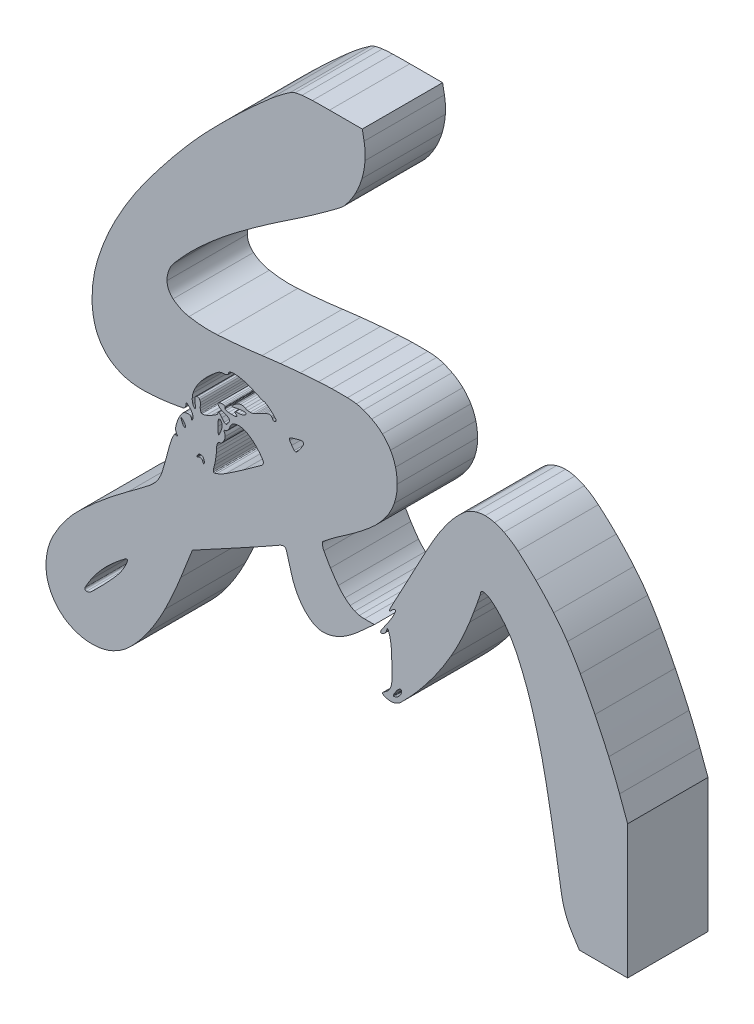
from build123d import *

# Parameters (mm, degrees)
BOSS_EXTRUDE1_DEPTH   = 30
BOSS_EXTRUDE1_2_DEPTH = 30
SCALE2_SCALE          = 5


with BuildPart() as part:
    # Sketch2 → Boss-Extrude1 (new body)
    with BuildSketch(Plane.XY):
        with BuildLine():
            ThreePointArc((52.205933, 32.830719), (55.316604025, 39.403493278), (58.132456, 46.107866))
            Line((58.132456, 46.107866), (62.463316, 57.096483))
            Line((62.463316, 57.096483), (75.981658, 64.427074))
            Line((75.981658, 64.427074), (81.431842, 67.396196))
            Line((81.431842, 67.396196), (86.628988, 70.255491))
            Line((86.628988, 70.255491), (91.027627, 72.699646))
            ThreePointArc((91.027627, 72.699646), (92.140192237, 73.330038689), (93.244684, 73.974472))
            ThreePointArc((93.244684, 73.974472), (94.193405236, 74.518840057), (95.156561, 75.037241))
            ThreePointArc((95.156561, 75.037241), (95.714736364, 75.280653681), (96.301076, 75.445017))
            ThreePointArc((96.301076, 75.445017), (96.661628518, 75.458328401), (97.006526, 75.352399))
            ThreePointArc((97.006526, 75.352399), (97.277256305, 75.142458922), (97.448336, 74.84564))
            ThreePointArc((97.448336, 74.84564), (97.584722485, 74.432549329), (97.712977, 74.016862))
            Line((97.712977, 74.016862), (98.252096, 72.190637))
            Line((98.252096, 72.190637), (98.881252, 70.017478))
            Line((98.881252, 70.017478), (99.540031, 67.696954))
            ThreePointArc((99.540031, 67.696954), (100.399634862, 65.158441242), (101.51929, 62.723418))
            ThreePointArc((101.51929, 62.723418), (102.821242901, 60.587452164), (104.385908, 58.635721))
            ThreePointArc((104.385908, 58.635721), (105.957436057, 57.154340061), (107.732624, 55.924341))
            ThreePointArc((107.732624, 55.924341), (109.370702684, 55.23520604), (111.132204, 55))
            ThreePointArc((111.132204, 55), (112.767826971, 55.112390142), (114.372704, 55.447448))
            ThreePointArc((114.372704, 55.447448), (116.076992824, 56.024401221), (117.712184, 56.775151))
            ThreePointArc((117.712184, 56.775151), (119.572331008, 57.850651444), (121.336141, 59.077771))
            ThreePointArc((121.336141, 59.077771), (123.434394622, 60.745044208), (125.458063, 62.502097))
            Line((125.458063, 62.502097), (130.416127, 67))
            Line((130.416127, 67), (126.74286, 67))
            ThreePointArc((126.74286, 67), (125.776359578, 67.044804048), (124.818149, 67.17883))
            ThreePointArc((124.818149, 67.17883), (123.937282305, 67.395744583), (123.086275, 67.710013))
            ThreePointArc((123.086275, 67.710013), (122.202725385, 68.14773376), (121.367352, 68.671576))
            ThreePointArc((121.367352, 68.671576), (120.398421536, 69.389600567), (119.470574, 70.15998))
            ThreePointArc((119.470574, 70.15998), (118.128741292, 71.468946929), (116.931392, 72.911259))
            ThreePointArc((116.931392, 72.911259), (115.442548949, 74.999656608), (114.042946, 77.148882))
            ThreePointArc((114.042946, 77.148882), (112.773467441, 79.274130095), (111.580068, 81.443013))
            ThreePointArc((111.580068, 81.443013), (111.147173123, 82.579351815), (111, 83.786416))
            ThreePointArc((111, 83.786416), (111.063228382, 84.066291309), (111.240632, 84.291804))
            ThreePointArc((111.240632, 84.291804), (112.34835413, 85.182624054), (113.46451, 86.062854))
            ThreePointArc((113.46451, 86.062854), (114.809133765, 87.091266413), (116.174215, 88.092365))
            ThreePointArc((116.174215, 88.092365), (117.774717462, 89.225786942), (119.389823, 90.338301))
            ThreePointArc((119.389823, 90.338301), (124.06857187, 93.695123638), (128.568897, 97.287619))
            ThreePointArc((128.568897, 97.287619), (131.731184867, 100.278663957), (134.524581, 103.61683))
            ThreePointArc((134.524581, 103.61683), (136.429867096, 106.641912637), (137.851853, 109.922034))
            ThreePointArc((137.851853, 109.922034), (138.700036382, 113.272462075), (138.97183, 116.717881))
            ThreePointArc((138.97183, 116.717881), (138.800083322, 119.308859264), (138.31787, 121.860356))
            ThreePointArc((138.31787, 121.860356), (137.548473217, 124.200386149), (136.457526, 126.408903))
            ThreePointArc((136.457526, 126.408903), (135.093523595, 128.394447014), (133.45681, 130.161947))
            ThreePointArc((133.45681, 130.161947), (131.555575721, 131.70651858), (129.459933, 132.974854))
            ThreePointArc((129.459933, 132.974854), (127.937259707, 133.704508123), (126.37564, 134.346593))
            ThreePointArc((126.37564, 134.346593), (125.05859014, 134.769215767), (123.705236, 135.054983))
            ThreePointArc((123.705236, 135.054983), (122.0357011, 135.258451148), (120.355918, 135.342563))
            ThreePointArc((120.355918, 135.342563), (117.441139182, 135.36223755), (114.526401, 135.337258))
            ThreePointArc((114.526401, 135.337258), (112.049192725, 135.265113029), (109.574666, 135.12916))
            ThreePointArc((109.574666, 135.12916), (106.15862278, 134.88004948), (102.745255, 134.596628))
            ThreePointArc((102.745255, 134.596628), (99.051005744, 134.252678279), (95.360357, 133.872033))
            ThreePointArc((95.360357, 133.872033), (91.927633407, 133.479363028), (88.5, 133.044495))
            ThreePointArc((88.5, 133.044495), (80.162358871, 132.076752683), (71.79692, 131.389572))
            ThreePointArc((71.79692, 131.389572), (66.481660806, 131.370094789), (61.204169, 132.002898))
            ThreePointArc((61.204169, 132.002898), (58.05921794, 133.00074728), (55.263813, 134.753497))
            ThreePointArc((55.263813, 134.753497), (53.594543038, 136.889898431), (53, 139.535119))
            ThreePointArc((53, 139.535119), (53.637052064, 143.145297593), (55.471258, 146.319398))
            ThreePointArc((55.471258, 146.319398), (60.106421235, 151.508700676), (65.0484, 156.406705))
            ThreePointArc((65.0484, 156.406705), (71.99511893, 162.543870883), (79.262043, 168.298306))
            ThreePointArc((79.262043, 168.298306), (88.583734752, 175.076331321), (98.093383, 181.588025))
            ThreePointArc((98.093383, 181.588025), (101.796729676, 184.072659154), (105.476729, 186.591744))
            ThreePointArc((105.476729, 186.591744), (108.814830501, 188.930009059), (112.124115, 191.308883))
            ThreePointArc((112.124115, 191.308883), (114.868921715, 193.326875117), (117.595088, 195.369979))
            ThreePointArc((117.595088, 195.369979), (118.590135994, 196.214278725), (119.484797, 197.164302))
            ThreePointArc((119.484797, 197.164302), (121.514905182, 199.846067811), (123.2583, 202.722486))
            ThreePointArc((123.2583, 202.722486), (124.689173289, 205.752233622), (125.79695, 208.914448))
            ThreePointArc((125.79695, 208.914448), (126.539795047, 212.073587082), (126.938575, 215.294294))
            ThreePointArc((126.938575, 215.294294), (126.955828524, 218.362734548), (126.583142, 221.408507))
            Line((126.583142, 221.408507), (125.909374, 225))
            Line((125.909374, 225), (113.677193, 225))
            ThreePointArc((113.677193, 225), (110.479442173, 224.98214943), (107.28209, 224.928595))
            ThreePointArc((107.28209, 224.928595), (105.338280051, 224.841016219), (103.400446, 224.665328))
            ThreePointArc((103.400446, 224.665328), (102.094680377, 224.466686338), (100.807683, 224.169836))
            ThreePointArc((100.807683, 224.169836), (99.855400121, 223.825515964), (98.972506, 223.329636))
            ThreePointArc((98.972506, 223.329636), (95.062743181, 220.507422649), (91.335896, 217.447726))
            ThreePointArc((91.335896, 217.447726), (85.969821472, 212.661364419), (80.699217, 207.770072))
            ThreePointArc((80.699217, 207.770072), (75.160083485, 202.419647957), (69.730355, 196.95823))
            ThreePointArc((69.730355, 196.95823), (65.086744959, 192.047365693), (60.591881, 187))
            ThreePointArc((60.591881, 187), (52.496515553, 177.235985556), (44.80593, 167.150064))
            ThreePointArc((44.80593, 167.150064), (38.96655884, 158.515240092), (33.771706, 149.477987))
            ThreePointArc((33.771706, 149.477987), (30.116733656, 141.717686758), (27.175383, 133.6598))
            ThreePointArc((27.175383, 133.6598), (25.547018373, 126.663870114), (25, 119.501791))
            ThreePointArc((25, 119.501791), (25.24502086, 115.760840554), (25.97589, 112.083807))
            ThreePointArc((25.97589, 112.083807), (27.129488375, 108.990074664), (28.8483, 106.170916))
            ThreePointArc((28.8483, 106.170916), (30.958679355, 103.889865828), (33.493679, 102.09246))
            ThreePointArc((33.493679, 102.09246), (36.460434973, 100.758959121), (39.618935, 99.98195))
            ThreePointArc((39.618935, 99.98195), (42.42623601, 99.689318785), (45.248596, 99.66006))
            ThreePointArc((45.248596, 99.66006), (48.777516873, 99.873611298), (52.292082, 100.25665))
            ThreePointArc((52.292082, 100.25665), (55.594868196, 100.748635328), (58.881107, 101.341156))
            ThreePointArc((58.881107, 101.341156), (59.684312292, 101.820365828), (60, 102.700776))
            ThreePointArc((60, 102.700776), (60.016341683, 103.050284307), (60.065224, 103.396743))
            ThreePointArc((60.065224, 103.396743), (60.147617327, 103.52972819), (60.297943, 103.57304))
            ThreePointArc((60.297943, 103.57304), (60.515500744, 103.517656597), (60.704107, 103.395893))
            ThreePointArc((60.704107, 103.395893), (61.147454041, 102.984687083), (61.580357, 102.5625))
            ThreePointArc((61.580357, 102.5625), (61.881759409, 102.228675462), (62.147608, 101.865899))
            ThreePointArc((62.147608, 101.865899), (62.369608809, 101.484715224), (62.549195, 101.081808))
            ThreePointArc((62.549195, 101.081808), (62.665501928, 100.712280998), (62.736489, 100.331442))
            ThreePointArc((62.736489, 100.331442), (62.735582447, 100.031329575), (62.659305, 99.741071))
            ThreePointArc((62.659305, 99.741071), (62.545015349, 99.471291154), (62.421751, 99.205492))
            ThreePointArc((62.421751, 99.205492), (62.356234551, 99.126867552), (62.261523, 99.088087))
            ThreePointArc((62.261523, 99.088087), (62.181454298, 99.107690146), (62.13762, 99.177503))
            ThreePointArc((62.13762, 99.177503), (62.101847393, 99.416152935), (62.078947, 99.65638))
            ThreePointArc((62.078947, 99.65638), (62.023604265, 99.874920854), (61.894875, 100.059993))
            ThreePointArc((61.894875, 100.059993), (61.69023687, 100.220141481), (61.453577, 100.327456))
            ThreePointArc((61.453577, 100.327456), (61.132877128, 100.399140596), (60.80462, 100.414449))
            ThreePointArc((60.80462, 100.414449), (60.420620841, 100.378252895), (60.04275, 100.300928))
            ThreePointArc((60.04275, 100.300928), (59.164454545, 99.8931146), (58.484637, 99.203504))
            ThreePointArc((58.484637, 99.203504), (57.707233572, 97.926324184), (57.068079, 96.574649))
            ThreePointArc((57.068079, 96.574649), (56.575322962, 95.16657539), (56.232943, 93.714592))
            ThreePointArc((56.232943, 93.714592), (56.236879927, 92.757358591), (56.583409, 91.865042))
            ThreePointArc((56.583409, 91.865042), (56.708347004, 91.648955188), (56.820393, 91.425911))
            ThreePointArc((56.820393, 91.425911), (56.843886271, 91.313518059), (56.815015, 91.202385))
            ThreePointArc((56.815015, 91.202385), (56.74624082, 91.141441753), (56.65435, 91.141231))
            ThreePointArc((56.65435, 91.141231), (56.470559183, 91.220615937), (56.295343, 91.317468))
            ThreePointArc((56.295343, 91.317468), (56.015803257, 91.363473351), (55.784871, 91.199372))
            ThreePointArc((55.784871, 91.199372), (55.409663596, 90.5557175), (55.080068, 89.887557))
            ThreePointArc((55.080068, 89.887557), (54.667158242, 88.895800664), (54.31242, 87.881781))
            ThreePointArc((54.31242, 87.881781), (53.911690232, 86.55714329), (53.547578, 85.221976))
            ThreePointArc((53.547578, 85.221976), (52.406887281, 80.986752657), (51.176491, 76.776715))
            ThreePointArc((51.176491, 76.776715), (50.418835848, 74.855340107), (49.362434, 73.08059))
            ThreePointArc((49.362434, 73.08059), (48.001772582, 71.433982237), (46.415936, 70.002955))
            ThreePointArc((46.415936, 70.002955), (42.487202767, 66.996249446), (38.511663, 64.051711))
            ThreePointArc((38.511663, 64.051711), (29.395572737, 56.953099953), (20.751811, 49.286369))
            ThreePointArc((20.751811, 49.286369), (15.132418008, 43.039650946), (10.589477, 35.971359))
            ThreePointArc((10.589477, 35.971359), (8.434830479, 30.263825158), (7.81506, 24.194696))
            ThreePointArc((7.81506, 24.194696), (8.900591634, 18.72030957), (11.729609, 13.909494))
            ThreePointArc((11.729609, 13.909494), (13.712015926, 11.938164679), (16.011173, 10.347582))
            ThreePointArc((16.011173, 10.347582), (18.631424511, 9.126034832), (21.413258, 8.33908))
            ThreePointArc((21.413258, 8.33908), (24.330910162, 7.997273938), (27.266051, 8.117581))
            ThreePointArc((27.266051, 8.117581), (30.122580762, 8.697806784), (32.848871, 9.729197))
            ThreePointArc((32.848871, 9.729197), (36.31256901, 11.756086156), (39.372333, 14.352878))
            ThreePointArc((39.372333, 14.352878), (42.798535733, 18.129514609), (45.886564, 22.187338))
            ThreePointArc((45.886564, 22.187338), (49.236759698, 27.395914955), (52.205933, 32.830719))
        make_face()
        with BuildLine():
            ThreePointArc((36.756634, 38.312099), (35.514650903, 36.407953693), (34.106864, 34.622897))
            ThreePointArc((34.106864, 34.622897), (31.839348801, 32.072237651), (29.501288, 29.586084))
            ThreePointArc((29.501288, 29.586084), (27.080535648, 27.121193585), (24.622356, 24.693627))
            ThreePointArc((24.622356, 24.693627), (23.83604833, 24.180020342), (22.914276, 24))
            ThreePointArc((22.914276, 24), (22.365779106, 24.309858669), (22.348072, 24.939579))
            ThreePointArc((22.348072, 24.939579), (23.440857797, 26.876046956), (24.63902, 28.749145))
            ThreePointArc((24.63902, 28.749145), (26.282880217, 31.030295174), (28.050551, 33.216905))
            ThreePointArc((28.050551, 33.216905), (29.880741219, 35.228718461), (31.830587, 37.124791))
            ThreePointArc((31.830587, 37.124791), (32.876746924, 38.06687523), (33.937303, 38.992723))
            ThreePointArc((33.937303, 38.992723), (34.887551705, 39.791082715), (35.855485, 40.567907))
            ThreePointArc((35.855485, 40.567907), (36.671521013, 41.198808305), (37.496225, 41.818336))
            ThreePointArc((37.496225, 41.818336), (37.756946979, 41.953411132), (38.046862, 42))
            ThreePointArc((38.046862, 42), (38.202856807, 41.927814392), (38.248803, 41.762182))
            ThreePointArc((38.248803, 41.762182), (38.159377126, 41.334745318), (38.033204, 40.916679))
            ThreePointArc((38.033204, 40.916679), (37.800199163, 40.3138956), (37.528755, 39.727417))
            ThreePointArc((37.528755, 39.727417), (37.154594494, 39.013266007), (36.756634, 38.312099))
        make_face(mode=Mode.SUBTRACT)
        with BuildLine():
            ThreePointArc((59.806872, 95.473539), (59.681986107, 95.403124208), (59.538684, 95.40751))
            ThreePointArc((59.538684, 95.40751), (59.362938345, 95.486492193), (59.210949, 95.604915))
            ThreePointArc((59.210949, 95.604915), (59.022667779, 95.819994408), (58.866277, 96.059266))
            ThreePointArc((58.866277, 96.059266), (58.703540989, 96.377592671), (58.564293, 96.706872))
            ThreePointArc((58.564293, 96.706872), (58.387232956, 97.183873624), (58.21821, 97.663782))
            ThreePointArc((58.21821, 97.663782), (58.212046852, 97.783763068), (58.270328, 97.888819))
            ThreePointArc((58.270328, 97.888819), (58.366000878, 97.929816324), (58.463552, 97.893514))
            ThreePointArc((58.463552, 97.893514), (58.797334731, 97.583794125), (59.124088, 97.266667))
            ThreePointArc((59.124088, 97.266667), (59.352495883, 97.01945083), (59.558688, 96.753423))
            ThreePointArc((59.558688, 96.753423), (59.714443687, 96.501098895), (59.837219, 96.231185))
            ThreePointArc((59.837219, 96.231185), (59.901287517, 96.009249215), (59.927901, 95.779789))
            ThreePointArc((59.927901, 95.779789), (59.899147687, 95.614112082), (59.806872, 95.473539))
        make_face(mode=Mode.SUBTRACT)
        with BuildLine():
            ThreePointArc((66.921053, 87.690983), (66.897774992, 87.424456834), (66.863366, 87.159138))
            ThreePointArc((66.863366, 87.159138), (66.821837873, 87.088723952), (66.743095, 87.066763))
            ThreePointArc((66.743095, 87.066763), (66.650831468, 87.102150351), (66.587621, 87.178106))
            ThreePointArc((66.587621, 87.178106), (66.457613242, 87.46541712), (66.335642, 87.756231))
            ThreePointArc((66.335642, 87.756231), (66.218250274, 87.983556031), (66.06066, 88.185107))
            ThreePointArc((66.06066, 88.185107), (65.877288917, 88.339760716), (65.663905, 88.449351))
            ThreePointArc((65.663905, 88.449351), (65.438767156, 88.505105224), (65.206832, 88.506396))
            ThreePointArc((65.206832, 88.506396), (64.974904343, 88.453760533), (64.760081, 88.351722))
            ThreePointArc((64.760081, 88.351722), (64.564299, 88.240985668), (64.360517, 88.14577))
            ThreePointArc((64.360517, 88.14577), (64.26435165, 88.140490513), (64.186645, 88.197388))
            ThreePointArc((64.186645, 88.197388), (64.15014118, 88.30169982), (64.170014, 88.410413))
            ThreePointArc((64.170014, 88.410413), (64.285864953, 88.639595776), (64.41459, 88.861803))
            ThreePointArc((64.41459, 88.861803), (64.731982927, 89.226167306), (65.149367, 89.469663))
            ThreePointArc((65.149367, 89.469663), (65.592737065, 89.543288292), (66.02967, 89.437992))
            ThreePointArc((66.02967, 89.437992), (66.433179003, 89.156299997), (66.717682, 88.754768))
            ThreePointArc((66.717682, 88.754768), (66.887577394, 88.235915649), (66.921053, 87.690983))
        make_face(mode=Mode.SUBTRACT)
        with BuildLine():
            ThreePointArc((85.923077, 102.923077), (86.522689437, 102.301591557), (87.099659, 101.65903))
            ThreePointArc((87.099659, 101.65903), (87.608941559, 101.043413465), (88.089881, 100.405409))
            ThreePointArc((88.089881, 100.405409), (88.462030194, 99.863561731), (88.810529, 99.306209))
            ThreePointArc((88.810529, 99.306209), (88.938833246, 99.001391801), (88.978644, 98.673077))
            ThreePointArc((88.978644, 98.673077), (88.806179919, 97.995915821), (88.349767, 97.466786))
            ThreePointArc((88.349767, 97.466786), (84.959792734, 95.023591451), (81.553414, 92.603321))
            ThreePointArc((81.553414, 92.603321), (78.324486777, 90.364951459), (75.059252, 88.179886))
            ThreePointArc((75.059252, 88.179886), (73.357171158, 87.187729612), (71.558411, 86.384041))
            ThreePointArc((71.558411, 86.384041), (71.142069805, 86.251890722), (70.713057, 86.169722))
            ThreePointArc((70.713057, 86.169722), (70.490442067, 86.215117095), (70.342873, 86.387864))
            ThreePointArc((70.342873, 86.387864), (70.268899548, 86.705280918), (70.289858, 87.030529))
            ThreePointArc((70.289858, 87.030529), (70.472066155, 87.829567319), (70.675297, 88.623519))
            ThreePointArc((70.675297, 88.623519), (70.837267573, 89.271291971), (70.97481, 89.924688))
            ThreePointArc((70.97481, 89.924688), (71.112003743, 90.692251392), (71.230998, 91.462846))
            ThreePointArc((71.230998, 91.462846), (71.330264774, 92.225099604), (71.411398, 92.989496))
            ThreePointArc((71.411398, 92.989496), (71.457168477, 93.619059085), (71.476094, 94.25))
            ThreePointArc((71.476094, 94.25), (71.501642824, 94.778328079), (71.56894, 95.302975))
            ThreePointArc((71.56894, 95.302975), (71.672787671, 95.755192643), (71.828737, 96.192188))
            ThreePointArc((71.828737, 96.192188), (71.993006959, 96.509343835), (72.203749, 96.797719))
            ThreePointArc((72.203749, 96.797719), (72.401211115, 96.947000199), (72.643011, 97))
            ThreePointArc((72.643011, 97), (73.152553424, 97.104544391), (73.579763, 97.401285))
            ThreePointArc((73.579763, 97.401285), (74.017108479, 97.948003557), (74.353654, 98.561933))
            ThreePointArc((74.353654, 98.561933), (74.59144374, 99.251715427), (74.712212, 99.97127))
            ThreePointArc((74.712212, 99.97127), (74.668081344, 100.552277205), (74.444227, 101.090242))
            ThreePointArc((74.444227, 101.090242), (74.359428465, 101.257988533), (74.30442, 101.437721))
            ThreePointArc((74.30442, 101.437721), (74.297142708, 101.58803784), (74.338421, 101.732759))
            ThreePointArc((74.338421, 101.732759), (74.421285246, 101.849072885), (74.5395, 101.929202))
            ThreePointArc((74.5395, 101.929202), (74.702837968, 101.982106242), (74.873595, 102))
            ThreePointArc((74.873595, 102), (75.098102468, 102.036624417), (75.299331, 102.1427))
            ThreePointArc((75.299331, 102.1427), (75.543293512, 102.351180357), (75.760399, 102.5875))
            ThreePointArc((75.760399, 102.5875), (75.988873808, 102.900149931), (76.183884, 103.234697))
            ThreePointArc((76.183884, 103.234697), (76.358096016, 103.610675923), (76.5, 104))
            ThreePointArc((76.5, 104), (77.021492683, 104.939658982), (77.866848, 105.603201))
            ThreePointArc((77.866848, 105.603201), (79.006227198, 105.982256197), (80.206421, 106.019708))
            ThreePointArc((80.206421, 106.019708), (81.70852742, 105.691594458), (83.113932, 105.06804))
            ThreePointArc((83.113932, 105.06804), (84.590076553, 104.089292646), (85.923077, 102.923077))
        make_face(mode=Mode.SUBTRACT)
        with BuildLine():
            ThreePointArc((73.09387, 100.919516), (72.785180234, 100.160991635), (72.46705, 99.406378))
            ThreePointArc((72.46705, 99.406378), (72.374180921, 99.331609552), (72.260197, 99.366576))
            ThreePointArc((72.260197, 99.366576), (72.156519371, 99.51933947), (72.116585, 99.699592))
            ThreePointArc((72.116585, 99.699592), (72.087023963, 100.82472599), (72.063386, 101.95))
            ThreePointArc((72.063386, 101.95), (72.061833491, 102.716756993), (72.085345, 103.483155))
            ThreePointArc((72.085345, 103.483155), (72.1407136, 103.905601648), (72.265378, 104.313015))
            ThreePointArc((72.265378, 104.313015), (72.395611535, 104.477139951), (72.594559, 104.542849))
            ThreePointArc((72.594559, 104.542849), (72.830403139, 104.501154049), (73.030484, 104.369516))
            ThreePointArc((73.030484, 104.369516), (73.255639406, 104.088782927), (73.414477, 103.765864))
            ThreePointArc((73.414477, 103.765864), (73.518376473, 103.383578248), (73.558204, 102.989432))
            ThreePointArc((73.558204, 102.989432), (73.536107547, 102.511051945), (73.452628, 102.039494))
            ThreePointArc((73.452628, 102.039494), (73.292928133, 101.473201263), (73.09387, 100.919516))
        make_face(mode=Mode.SUBTRACT)
        with BuildLine():
            ThreePointArc((81.744405, 121.432481), (83.28367256, 120.943210856), (84.782119, 120.340394))
            Line((84.782119, 120.340394), (86.242778, 119.697508))
            ThreePointArc((86.242778, 119.697508), (86.897741805, 119.416153253), (87.554747, 119.139599))
            Line((87.554747, 119.139599), (88.664142, 118.683117))
            ThreePointArc((88.664142, 118.683117), (88.829656172, 118.624995716), (89, 118.583091))
            ThreePointArc((89, 118.583091), (89.744757478, 118.354173164), (90.425249, 117.974702))
            ThreePointArc((90.425249, 117.974702), (91.325946249, 117.290049696), (92.175024, 116.542339))
            ThreePointArc((92.175024, 116.542339), (92.913418525, 115.79674519), (93.60226, 115.005143))
            ThreePointArc((93.60226, 115.005143), (93.721897224, 114.629310697), (93.552763, 114.273001))
            ThreePointArc((93.552763, 114.273001), (93.390019505, 114.153099542), (93.203917, 114.074184))
            ThreePointArc((93.203917, 114.074184), (93.021911837, 114.050577436), (92.841389, 114.083663))
            ThreePointArc((92.841389, 114.083663), (92.66523312, 114.174047425), (92.520288, 114.308922))
            ThreePointArc((92.520288, 114.308922), (92.388778078, 114.501693816), (92.291782, 114.713938))
            ThreePointArc((92.291782, 114.713938), (92.161841718, 114.974602039), (91.974202, 115.197361))
            ThreePointArc((91.974202, 115.197361), (91.756480815, 115.343240377), (91.503695, 115.412397))
            ThreePointArc((91.503695, 115.412397), (91.167393227, 115.411992135), (90.838792, 115.340436))
            ThreePointArc((90.838792, 115.340436), (90.377032188, 115.168400521), (89.928687, 114.963938))
            Line((89.928687, 114.963938), (89.044239, 114.521059))
            Line((89.044239, 114.521059), (87.972286, 113.982692))
            Line((87.972286, 113.982692), (86.891401, 113.438678))
            Line((86.891401, 113.438678), (85.976968, 112.977143))
            ThreePointArc((85.976968, 112.977143), (85.503064821, 112.767722304), (85.009975, 112.608651))
            ThreePointArc((85.009975, 112.608651), (84.523150796, 112.509423527), (84.028033, 112.468165))
            ThreePointArc((84.028033, 112.468165), (83.551140967, 112.486081402), (83.080084, 112.562582))
            ThreePointArc((83.080084, 112.562582), (82.635536194, 112.695187355), (82.212754, 112.886138))
            ThreePointArc((82.212754, 112.886138), (81.772936442, 113.08157375), (81.309302, 113.210716))
            ThreePointArc((81.309302, 113.210716), (80.861932608, 113.259663507), (80.412992, 113.228238))
            ThreePointArc((80.412992, 113.228238), (79.937020054, 113.112480129), (79.485287, 112.923043))
            ThreePointArc((79.485287, 112.923043), (78.971193707, 112.627718242), (78.485786, 112.287295))
            ThreePointArc((78.485786, 112.287295), (77.868751264, 111.80365627), (77.259626, 111.310093))
            ThreePointArc((77.259626, 111.310093), (77.204168773, 111.18651436), (77.268867, 111.067513))
            ThreePointArc((77.268867, 111.067513), (77.44934244, 110.98744688), (77.64671, 110.982154))
            ThreePointArc((77.64671, 110.982154), (78.723841963, 111.169130477), (79.799711, 111.363242))
            ThreePointArc((79.799711, 111.363242), (80.476388121, 111.474620031), (81.156754, 111.560639))
            ThreePointArc((81.156754, 111.560639), (81.608011718, 111.581136458), (82.058362, 111.545947))
            ThreePointArc((82.058362, 111.545947), (82.278007455, 111.474452453), (82.459816, 111.33197))
            ThreePointArc((82.459816, 111.33197), (82.532978943, 111.163592185), (82.490694, 110.984942))
            ThreePointArc((82.490694, 110.984942), (82.319955323, 110.771602576), (82.102947, 110.605552))
            ThreePointArc((82.102947, 110.605552), (81.767631742, 110.429007061), (81.417179, 110.284829))
            ThreePointArc((81.417179, 110.284829), (81.000506598, 110.15592324), (80.574282, 110.063375))
            ThreePointArc((80.574282, 110.063375), (80.134243755, 110.005944128), (79.690983, 109.984687))
            ThreePointArc((79.690983, 109.984687), (79.201203305, 109.972538325), (78.712167, 109.942954))
            ThreePointArc((78.712167, 109.942954), (78.508663847, 109.892033681), (78.333089, 109.77723))
            ThreePointArc((78.333089, 109.77723), (78.276530264, 109.651895543), (78.327251, 109.524087))
            ThreePointArc((78.327251, 109.524087), (78.547719651, 109.324606041), (78.789345, 109.151354))
            ThreePointArc((78.789345, 109.151354), (78.958545487, 109.004275285), (79.076646, 108.813715))
            ThreePointArc((79.076646, 108.813715), (79.08014508, 108.658486493), (78.975265, 108.543995))
            ThreePointArc((78.975265, 108.543995), (78.662604803, 108.429113332), (78.333876, 108.37534))
            ThreePointArc((78.333876, 108.37534), (77.70895717, 108.343837566), (77.083333, 108.333333))
            ThreePointArc((77.083333, 108.333333), (76.525854984, 108.34809289), (75.969939, 108.392331))
            ThreePointArc((75.969939, 108.392331), (75.539472337, 108.461994736), (75.119153, 108.578125))
            ThreePointArc((75.119153, 108.578125), (74.870605637, 108.690474306), (74.649463, 108.850143))
            ThreePointArc((74.649463, 108.850143), (74.568526477, 108.999935053), (74.603006, 109.166667))
            ThreePointArc((74.603006, 109.166667), (74.66317384, 109.318679393), (74.667018, 109.482121))
            ThreePointArc((74.667018, 109.482121), (74.613593617, 109.633551882), (74.508783, 109.755208))
            ThreePointArc((74.508783, 109.755208), (74.324914044, 109.870109057), (74.119675, 109.940016))
            ThreePointArc((74.119675, 109.940016), (73.840945833, 109.98496131), (73.559017, 110))
            ThreePointArc((73.559017, 110), (72.943519055, 109.927847718), (72.361395, 109.715303))
            ThreePointArc((72.361395, 109.715303), (72.086911897, 109.418228958), (72.074929, 109.013939))
            ThreePointArc((72.074929, 109.013939), (72.364217418, 108.489479929), (72.816247, 108.096524))
            ThreePointArc((72.816247, 108.096524), (73.621627901, 107.67062146), (74.467954, 107.333333))
            ThreePointArc((74.467954, 107.333333), (75.069736885, 107.109429847), (75.656722, 106.849192))
            ThreePointArc((75.656722, 106.849192), (75.966569832, 106.642981889), (76.207735, 106.35949))
            ThreePointArc((76.207735, 106.35949), (76.314027136, 106.075503607), (76.296851, 105.772764))
            ThreePointArc((76.296851, 105.772764), (76.153670917, 105.372529318), (75.948951, 105))
            ThreePointArc((75.948951, 105), (75.669212018, 104.615627183), (75.354509, 104.259315))
            ThreePointArc((75.354509, 104.259315), (75.134073059, 104.12236798), (74.87515, 104.104894))
            ThreePointArc((74.87515, 104.104894), (74.585142926, 104.208176937), (74.344351, 104.399986))
            ThreePointArc((74.344351, 104.399986), (73.902111594, 104.911799274), (73.480997, 105.44113))
            ThreePointArc((73.480997, 105.44113), (73.203914766, 105.786841691), (72.910628, 106.118917))
            ThreePointArc((72.910628, 106.118917), (72.686139669, 106.330320461), (72.435043, 106.509309))
            ThreePointArc((72.435043, 106.509309), (72.293800696, 106.559206526), (72.144528, 106.546684))
            ThreePointArc((72.144528, 106.546684), (72.040069887, 106.473021014), (72, 106.351645))
            ThreePointArc((72, 106.351645), (71.884426063, 105.873335072), (71.563207, 105.500567))
            ThreePointArc((71.563207, 105.500567), (70.639973459, 104.875795607), (69.683761, 104.302771))
            ThreePointArc((69.683761, 104.302771), (68.656278001, 103.768015004), (67.596252, 103.301078))
            ThreePointArc((67.596252, 103.301078), (66.833064792, 103.0759617), (66.041003, 103))
            ThreePointArc((66.041003, 103), (65.862857685, 103.045754675), (65.72881, 103.171693))
            ThreePointArc((65.72881, 103.171693), (65.597167436, 103.419881985), (65.505414, 103.685417))
            ThreePointArc((65.505414, 103.685417), (65.42999362, 104.059354645), (65.396979, 104.439391))
            ThreePointArc((65.396979, 104.439391), (65.398985159, 104.88697859), (65.432248, 105.333333))
            ThreePointArc((65.432248, 105.333333), (65.461907619, 105.809092338), (65.446711, 106.285533))
            ThreePointArc((65.446711, 106.285533), (65.382605455, 106.664986012), (65.252758, 107.027248))
            ThreePointArc((65.252758, 107.027248), (65.092778965, 107.284257185), (64.874523, 107.494046))
            ThreePointArc((64.874523, 107.494046), (64.628650119, 107.622382669), (64.354857, 107.666667))
            ThreePointArc((64.354857, 107.666667), (64.07353174, 107.622516075), (63.819256, 107.494309))
            ThreePointArc((63.819256, 107.494309), (63.612922233, 107.293047208), (63.475424, 107.039721))
            ThreePointArc((63.475424, 107.039721), (63.378502546, 106.663933185), (63.35397, 106.276624))
            ThreePointArc((63.35397, 106.276624), (63.390593722, 105.741544321), (63.466693, 105.210639))
            ThreePointArc((63.466693, 105.210639), (63.53913384, 104.761178649), (63.593916, 104.309226))
            ThreePointArc((63.593916, 104.309226), (63.609116164, 103.98824667), (63.589812, 103.667488))
            ThreePointArc((63.589812, 103.667488), (63.547693654, 103.524551343), (63.459661, 103.404322))
            ThreePointArc((63.459661, 103.404322), (63.35964515, 103.364584635), (63.260417, 103.40625))
            ThreePointArc((63.260417, 103.40625), (62.848031176, 103.942979001), (62.587822, 104.567824))
            ThreePointArc((62.587822, 104.567824), (62.435518576, 105.366837467), (62.405911, 106.179698))
            ThreePointArc((62.405911, 106.179698), (62.504442792, 107.13443152), (62.722683, 108.069095))
            ThreePointArc((62.722683, 108.069095), (63.077327801, 109.075478784), (63.523215, 110.044894))
            ThreePointArc((63.523215, 110.044894), (64.493547529, 111.70426672), (65.630552, 113.254197))
            ThreePointArc((65.630552, 113.254197), (67.126439427, 114.973160922), (68.727001, 116.59511))
            ThreePointArc((68.727001, 116.59511), (70.284023308, 117.995699935), (71.91741, 119.306432))
            ThreePointArc((71.91741, 119.306432), (72.893188768, 119.821976044), (73.982334, 120))
            ThreePointArc((73.982334, 120), (74.370186943, 120.018458615), (74.754534, 120.073667))
            ThreePointArc((74.754534, 120.073667), (75.088358825, 120.161650546), (75.40731, 120.29375))
            ThreePointArc((75.40731, 120.29375), (75.641552505, 120.436613343), (75.847335, 120.618088))
            ThreePointArc((75.847335, 120.618088), (75.960419847, 120.794352665), (76, 121))
            ThreePointArc((76, 121), (76.193605385, 121.535348466), (76.684852, 121.823025))
            ThreePointArc((76.684852, 121.823025), (77.758188411, 121.950626134), (78.839023, 121.939238))
            ThreePointArc((78.839023, 121.939238), (80.304103449, 121.756891732), (81.744405, 121.432481))
        make_face(mode=Mode.SUBTRACT)
        with BuildLine():
            ThreePointArc((103.968197, 112.25), (103.938686157, 112.041978137), (103.869013, 111.843762))
            ThreePointArc((103.869013, 111.843762), (103.697971742, 111.493745087), (103.514453, 111.150106))
            ThreePointArc((103.514453, 111.150106), (103.280961348, 110.749058354), (103.03261, 110.357039))
            ThreePointArc((103.03261, 110.357039), (102.756801623, 109.953430165), (102.468197, 109.55887))
            ThreePointArc((102.468197, 109.55887), (101.987723493, 108.94275107), (101.489267, 108.341088))
            ThreePointArc((101.489267, 108.341088), (101.27161126, 108.176267142), (101.004938, 108.117741))
            ThreePointArc((101.004938, 108.117741), (100.739608661, 108.176742319), (100.524287, 108.342626))
            ThreePointArc((100.524287, 108.342626), (100.037991681, 108.943510379), (99.570148, 109.55887))
            ThreePointArc((99.570148, 109.55887), (99.17256875, 110.125206525), (98.801213, 110.709074))
            ThreePointArc((98.801213, 110.709074), (98.701958969, 110.99205063), (98.724537, 111.291078))
            ThreePointArc((98.724537, 111.291078), (98.865059216, 111.545462267), (99.101556, 111.714362))
            ThreePointArc((99.101556, 111.714362), (99.705004277, 111.948686584), (100.320148, 112.15032))
            ThreePointArc((100.320148, 112.15032), (101.336508138, 112.445381419), (102.357113, 112.725408))
            ThreePointArc((102.357113, 112.725408), (102.837492851, 112.82385176), (103.326061, 112.86577))
            ThreePointArc((103.326061, 112.86577), (103.57455083, 112.82369377), (103.78837, 112.690281))
            ThreePointArc((103.78837, 112.690281), (103.926372532, 112.489781834), (103.968197, 112.25))
        make_face(mode=Mode.SUBTRACT)
    extrude(amount=BOSS_EXTRUDE1_DEPTH)


with BuildPart() as body_2:
    # Sketch2 → Boss-Extrude1 2 (new body)
    with BuildSketch(Plane.XY):
        with BuildLine():
            ThreePointArc((150.087265, 100.967716), (147.544388193, 96.238402159), (145.018487, 91.5))
            Line((145.018487, 91.5), (143.175861, 88.034662))
            Line((143.175861, 88.034662), (141.148715, 84.234375))
            Line((141.148715, 84.234375), (139.24149, 80.668695))
            Line((139.24149, 80.668695), (137.807495, 78))
            ThreePointArc((137.807495, 78), (137.276025532, 76.999028917), (136.757212, 75.99144))
            ThreePointArc((136.757212, 75.99144), (136.432651165, 75.316987197), (136.136265, 74.629687))
            ThreePointArc((136.136265, 74.629687), (136.098220798, 74.457736398), (136.119246, 74.282887))
            ThreePointArc((136.119246, 74.282887), (136.190525974, 74.217651079), (136.281576, 74.25))
            ThreePointArc((136.281576, 74.25), (137.012192291, 75.010807155), (137.850872, 75.650529))
            ThreePointArc((137.850872, 75.650529), (138.213093623, 75.633996194), (138.314945, 75.285996))
            ThreePointArc((138.314945, 75.285996), (137.691470807, 73.768865098), (136.906921, 72.328418))
            ThreePointArc((136.906921, 72.328418), (135.581965522, 70.262498999), (134.187054, 68.243155))
            ThreePointArc((134.187054, 68.243155), (133.656589908, 67.485586892), (133.142545, 66.716783))
            ThreePointArc((133.142545, 66.716783), (132.92489912, 66.321611948), (132.768899, 65.898299))
            ThreePointArc((132.768899, 65.898299), (132.788790677, 65.715423728), (132.93067, 65.598337))
            ThreePointArc((132.93067, 65.598337), (133.185204926, 65.563459941), (133.437054, 65.614219))
            ThreePointArc((133.437054, 65.614219), (133.753256515, 65.765753843), (134.041082, 65.966012))
            ThreePointArc((134.041082, 65.966012), (134.320848884, 66.226894464), (134.566133, 66.520433))
            ThreePointArc((134.566133, 66.520433), (134.772110024, 66.840668982), (134.936635, 67.184048))
            ThreePointArc((134.936635, 67.184048), (135.039299449, 67.514304407), (135.085953, 67.856989))
            ThreePointArc((135.085953, 67.856989), (135.12190622, 68.019600559), (135.208707, 68.16173))
            ThreePointArc((135.208707, 68.16173), (135.308317629, 68.205046934), (135.404472, 68.15452))
            ThreePointArc((135.404472, 68.15452), (135.57417332, 67.888603508), (135.703988, 67.6011))
            ThreePointArc((135.703988, 67.6011), (135.884806126, 67.084546689), (136.049574, 66.562652))
            ThreePointArc((136.049574, 66.562652), (136.329868441, 65.486997605), (136.533278, 64.394193))
            ThreePointArc((136.533278, 64.394193), (136.696958927, 63.1052214), (136.803059, 61.810238))
            ThreePointArc((136.803059, 61.810238), (136.88912077, 59.951022478), (136.926022, 58.090182))
            ThreePointArc((136.926022, 58.090182), (136.937430583, 54.933607824), (136.929906, 51.777022))
            ThreePointArc((136.929906, 51.777022), (136.890938506, 51.182976935), (136.780997, 50.597895))
            ThreePointArc((136.780997, 50.597895), (136.597724228, 50.0013967), (136.353253, 49.42726))
            ThreePointArc((136.353253, 49.42726), (136.057781357, 48.896957065), (135.707316, 48.401277))
            ThreePointArc((135.707316, 48.401277), (135.33724548, 47.997350609), (134.912556, 47.651305))
            ThreePointArc((134.912556, 47.651305), (134.328682469, 47.231097458), (133.755761, 46.796076))
            ThreePointArc((133.755761, 46.796076), (133.590237119, 46.607255201), (133.505997, 46.370707))
            ThreePointArc((133.505997, 46.370707), (133.537851648, 46.166952497), (133.68169, 46.019165))
            ThreePointArc((133.68169, 46.019165), (134.132281383, 45.796190239), (134.595837, 45.601597))
            ThreePointArc((134.595837, 45.601597), (137.615032991, 45.35719329), (140.286981, 46.784068))
            ThreePointArc((140.286981, 46.784068), (145.122717813, 51.846511489), (149.622925, 57.209423))
            ThreePointArc((149.622925, 57.209423), (154.526470636, 63.922819794), (158.946559, 70.963933))
            ThreePointArc((158.946559, 70.963933), (162.732295642, 78.108536907), (165.961903, 85.521148))
            ThreePointArc((165.961903, 85.521148), (166.742163193, 87.536309085), (167.509159, 89.556556))
            ThreePointArc((167.509159, 89.556556), (168.170074052, 91.340780926), (168.813809, 93.131276))
            ThreePointArc((168.813809, 93.131276), (169.348005231, 94.651537549), (169.874825, 96.174371))
            ThreePointArc((169.874825, 96.174371), (169.96849156, 96.544319251), (170, 96.924638))
            ThreePointArc((170, 96.924638), (170.166471161, 97.456638858), (170.606498, 97.798858))
            ThreePointArc((170.606498, 97.798858), (171.272874804, 97.918277487), (171.938499, 97.794732))
            ThreePointArc((171.938499, 97.794732), (173.029996537, 97.283027157), (174.033514, 96.615074))
            ThreePointArc((174.033514, 96.615074), (175.287693006, 95.57438623), (176.475157, 94.458176))
            ThreePointArc((176.475157, 94.458176), (180.385473223, 89.809946164), (183.442465, 84.561002))
            ThreePointArc((183.442465, 84.561002), (186.630190894, 77.110322081), (189.256874, 69.443852))
            ThreePointArc((189.256874, 69.443852), (192.203420013, 58.681358725), (194.591855, 47.781415))
            ThreePointArc((194.591855, 47.781415), (197.462860468, 32.076940712), (200.046427, 16.322628))
            ThreePointArc((200.046427, 16.322628), (200.346350138, 14.604306082), (200.71269, 12.898909))
            ThreePointArc((200.71269, 12.898909), (201.120555326, 11.337195944), (201.604317, 9.797301))
            ThreePointArc((201.604317, 9.797301), (202.12497749, 8.394112014), (202.719106, 7.020417))
            ThreePointArc((202.719106, 7.020417), (203.347643584, 5.774703133), (204.056077, 4.572628))
            Line((204.056077, 4.572628), (206.955952, 0))
            Line((206.955952, 0), (225, 0))
            Line((225, 0), (225, 49.863562))
            Line((225, 49.863562), (221.988108, 58.032252))
            ThreePointArc((221.988108, 58.032252), (220.043373983, 63.064892236), (217.94357, 68.03483))
            ThreePointArc((217.94357, 68.03483), (215.421544692, 73.592788406), (212.780851, 79.095356))
            ThreePointArc((212.780851, 79.095356), (210.120696375, 84.345212092), (207.347436, 89.536208))
            ThreePointArc((207.347436, 89.536208), (205.014083214, 93.584212888), (202.509644, 97.52866))
            ThreePointArc((202.509644, 97.52866), (200.046360275, 101.000087307), (197.379196, 104.317437))
            ThreePointArc((197.379196, 104.317437), (194.147707242, 107.947131507), (190.772086, 111.443184))
            ThreePointArc((190.772086, 111.443184), (187.479031574, 114.58994718), (184.0627, 117.602422))
            ThreePointArc((184.0627, 117.602422), (181.541011115, 119.499298932), (178.817595, 121.093056))
            ThreePointArc((178.817595, 121.093056), (177.082284653, 121.866478404), (175.275502, 122.453863))
            ThreePointArc((175.275502, 122.453863), (173.550498226, 122.795950183), (171.795459, 122.907749))
            ThreePointArc((171.795459, 122.907749), (170.109732989, 122.786399472), (168.45701, 122.432981))
            ThreePointArc((168.45701, 122.432981), (166.847731771, 121.851119194), (165.330414, 121.059863))
            ThreePointArc((165.330414, 121.059863), (164.560492957, 120.541546334), (163.840224, 119.956189))
            ThreePointArc((163.840224, 119.956189), (162.866238445, 119.06057729), (161.921613, 118.134051))
            ThreePointArc((161.921613, 118.134051), (160.911189625, 117.077582179), (159.934725, 115.989649))
            ThreePointArc((159.934725, 115.989649), (159.036148406, 114.917507012), (158.176893, 113.813601))
            ThreePointArc((158.176893, 113.813601), (156.75043417, 111.862038162), (155.371868, 109.876355))
            ThreePointArc((155.371868, 109.876355), (154.150839771, 108.009510282), (152.988146, 106.105787))
            ThreePointArc((152.988146, 106.105787), (151.513502617, 103.5504161), (150.087265, 100.967716))
        make_face()
        with BuildLine():
            ThreePointArc((140.391296, 49.577319), (140.253368954, 49.275447561), (140.079066, 48.993014))
            ThreePointArc((140.079066, 48.993014), (139.847760193, 48.693191694), (139.592116, 48.413832))
            ThreePointArc((139.592116, 48.413832), (139.314549842, 48.157502682), (139.016429, 47.9254))
            ThreePointArc((139.016429, 47.9254), (138.736724835, 47.751516322), (138.437314, 47.614319))
            ThreePointArc((138.437314, 47.614319), (138.092441636, 47.496730194), (137.739672, 47.405529))
            ThreePointArc((137.739672, 47.405529), (137.603671468, 47.433023696), (137.532097, 47.55189))
            ThreePointArc((137.532097, 47.55189), (137.539271015, 47.76300227), (137.613004, 47.96095))
            ThreePointArc((137.613004, 47.96095), (137.9286601, 48.502216704), (138.25518, 49.037))
            ThreePointArc((138.25518, 49.037), (138.733540775, 49.739086188), (139.266276, 50.400862))
            ThreePointArc((139.266276, 50.400862), (139.670000489, 50.74216473), (140.157113, 50.947597))
            ThreePointArc((140.157113, 50.947597), (140.440702599, 50.889977673), (140.572779, 50.632492))
            ThreePointArc((140.572779, 50.632492), (140.533928798, 50.095980529), (140.391296, 49.577319))
        make_face(mode=Mode.SUBTRACT)
    extrude(amount=BOSS_EXTRUDE1_2_DEPTH)


with BuildPart() as part_1:
    # Scale2: scaled about (0, 0, 0)
    add(part.part.scale(SCALE2_SCALE))


with BuildPart() as body_2_1:
    # Scale2: scaled about (0, 0, 0)
    add(body_2.part.scale(SCALE2_SCALE))


solid = Compound([part_1.part, body_2_1.part])
